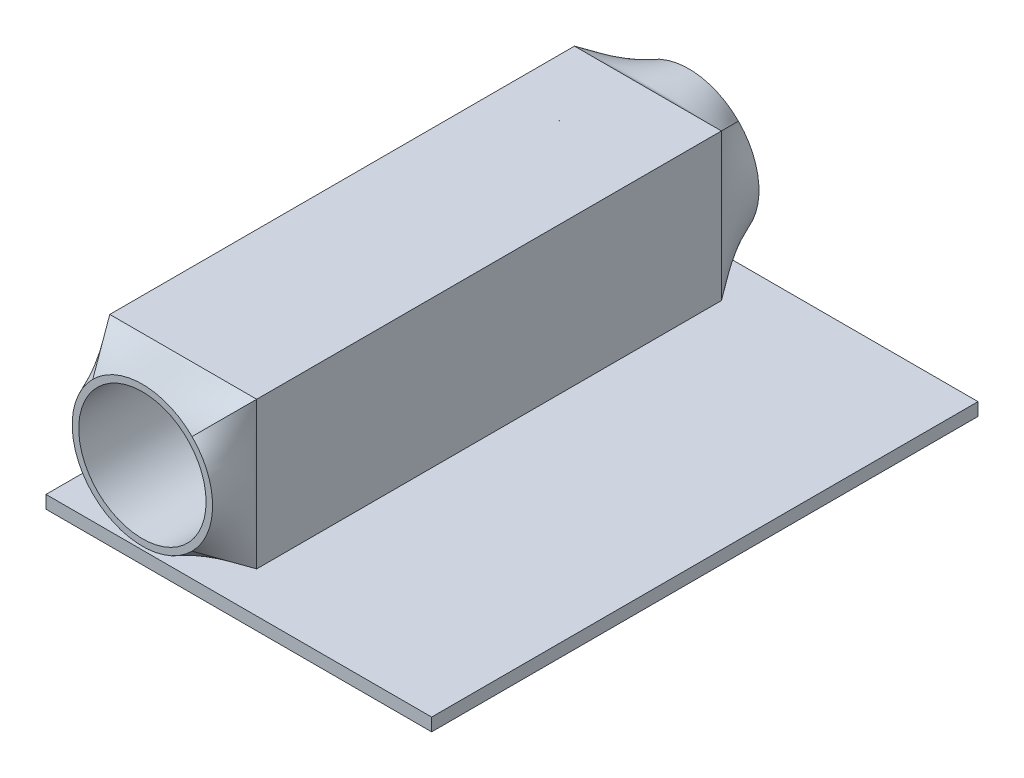
from build123d import *

# Parameters (mm, degrees)
SKETCH1_W                = 60
SKETCH1_H                = 85
FLOOR_2_DEPTH            = 2
BOSS_EXTRUDE2_DEPTH      = 36.15
BOSS_EXTRUDE2_DEPTH_BACK = 36.15
SKETCH4_W                = 22.86
SKETCH4_H                = 22.86
SKETCH8_R                = 9.906
CUT_EXTRUDE1_DEPTH       = 85
SKETCH9_R                = 10
CUT_EXTRUDE3_DEPTH       = 12.7


with BuildPart() as part:
    # Sketch1 → Floor 2 (new body)
    with BuildSketch(Plane(origin=(0, 0, 0), x_dir=(1, 0, 0), z_dir=(0, 1, 0))):
        Rectangle(SKETCH1_W, SKETCH1_H)
    extrude(amount=FLOOR_2_DEPTH)


with BuildPart() as body_2:
    # Sketch4 → Boss-Extrude2 (new, two sides: drawn at the far end of the back side and taken through both)
    with BuildSketch(Plane.XY.offset(-BOSS_EXTRUDE2_DEPTH_BACK)):
        with Locations((-15, 13.43)):
            Rectangle(SKETCH4_W, SKETCH4_H)
    extrude(amount=BOSS_EXTRUDE2_DEPTH + BOSS_EXTRUDE2_DEPTH_BACK)

    # Loft1: read off the stored shape, not the designer's step
    # Loft1: loft between two sections, ruled curve by curve
    loft1_from = [
        Edge.make_bspline([(-22.723020264, 21.153020264, 42.5), (-22.267936931, 21.608103597, 42.5), (-21.755379228, 22.039749576, 42.5), (-20.622186662, 22.819033678, 42.5), (-20.00149393, 23.16641949, 42.5), (-18.674448049, 23.740734093, 42.5), (-17.968198796, 23.967381387, 42.5), (-16.507843764, 24.27310923, 42.5), (-15.754006755, 24.352, 42.5), (-14.245993245, 24.352, 42.5), (-13.492156236, 24.27310923, 42.5), (-12.031801204, 23.967381387, 42.5), (-11.325551951, 23.740734093, 42.5), (-9.99850607, 23.16641949, 42.5), (-9.377813338, 22.819033678, 42.5), (-8.244620772, 22.039749576, 42.5), (-7.732063069, 21.608103597, 42.5), (-7.276979736, 21.153020264, 42.5)], [0, 0, 0, 0, 0.125, 0.125, 0.25, 0.25, 0.375, 0.375, 0.5, 0.5, 0.625, 0.625, 0.75, 0.75, 0.875, 0.875, 1, 1, 1, 1], 3),
        Edge.make_bspline([(-7.276979736, 21.153020264, 42.5), (-6.821896403, 20.697936931, 42.5), (-6.390250424, 20.185379228, 42.5), (-5.610966322, 19.052186662, 42.5), (-5.26358051, 18.43149393, 42.5), (-4.689265907, 17.104448049, 42.5), (-4.462618613, 16.398198796, 42.5), (-4.15689077, 14.937843764, 42.5), (-4.078, 14.184006755, 42.5), (-4.078, 12.675993245, 42.5), (-4.15689077, 11.922156236, 42.5), (-4.462618613, 10.461801204, 42.5), (-4.689265907, 9.755551951, 42.5), (-5.26358051, 8.42850607, 42.5), (-5.610966322, 7.807813338, 42.5), (-6.390250424, 6.674620772, 42.5), (-6.821896403, 6.162063069, 42.5), (-7.276979736, 5.706979736, 42.5)], [0, 0, 0, 0, 0.125, 0.125, 0.25, 0.25, 0.375, 0.375, 0.5, 0.5, 0.625, 0.625, 0.75, 0.75, 0.875, 0.875, 1, 1, 1, 1], 3),
        Edge.make_bspline([(-22.723020264, 5.706979736, 42.5), (-23.178103597, 6.162063069, 42.5), (-23.609749576, 6.674620772, 42.5), (-24.389033678, 7.807813338, 42.5), (-24.73641949, 8.42850607, 42.5), (-25.310734093, 9.755551951, 42.5), (-25.537381387, 10.461801204, 42.5), (-25.84310923, 11.922156236, 42.5), (-25.922, 12.675993245, 42.5), (-25.922, 14.184006755, 42.5), (-25.84310923, 14.937843764, 42.5), (-25.537381387, 16.398198796, 42.5), (-25.310734093, 17.104448049, 42.5), (-24.73641949, 18.43149393, 42.5), (-24.389033678, 19.052186662, 42.5), (-23.609749576, 20.185379228, 42.5), (-23.178103597, 20.697936931, 42.5), (-22.723020264, 21.153020264, 42.5)], [0, 0, 0, 0, 0.125, 0.125, 0.25, 0.25, 0.375, 0.375, 0.5, 0.5, 0.625, 0.625, 0.75, 0.75, 0.875, 0.875, 1, 1, 1, 1], 3),
        Edge.make_bspline([(-7.276979736, 5.706979736, 42.5), (-7.732063069, 5.251896403, 42.5), (-8.244620772, 4.820250424, 42.5), (-9.377813338, 4.040966322, 42.5), (-9.99850607, 3.69358051, 42.5), (-11.325551951, 3.119265907, 42.5), (-12.031801204, 2.892618613, 42.5), (-13.492156236, 2.58689077, 42.5), (-14.245993245, 2.508, 42.5), (-15.754006755, 2.508, 42.5), (-16.507843764, 2.58689077, 42.5), (-17.968198796, 2.892618613, 42.5), (-18.674448049, 3.119265907, 42.5), (-20.00149393, 3.69358051, 42.5), (-20.622186662, 4.040966322, 42.5), (-21.755379228, 4.820250424, 42.5), (-22.267936931, 5.251896403, 42.5), (-22.723020264, 5.706979736, 42.5)], [0, 0, 0, 0, 0.125, 0.125, 0.25, 0.25, 0.375, 0.375, 0.5, 0.5, 0.625, 0.625, 0.75, 0.75, 0.875, 0.875, 1, 1, 1, 1], 3),
    ]
    loft1_to = [
        Edge.make_bspline([(-26.43, 24.86, 36.15), (-25.4775, 24.86, 36.15), (-24.525, 24.86, 36.15), (-22.62, 24.86, 36.15), (-21.6675, 24.86, 36.15), (-19.7625, 24.86, 36.15), (-18.81, 24.86, 36.15), (-16.905, 24.86, 36.15), (-15.9525, 24.86, 36.15), (-14.0475, 24.86, 36.15), (-13.095, 24.86, 36.15), (-11.19, 24.86, 36.15), (-10.2375, 24.86, 36.15), (-8.3325, 24.86, 36.15), (-7.38, 24.86, 36.15), (-5.475, 24.86, 36.15), (-4.5225, 24.86, 36.15), (-3.57, 24.86, 36.15)], [0, 0, 0, 0, 0.125, 0.125, 0.25, 0.25, 0.375, 0.375, 0.5, 0.5, 0.625, 0.625, 0.75, 0.75, 0.875, 0.875, 1, 1, 1, 1], 3),
        Edge.make_bspline([(-3.57, 24.86, 36.15), (-3.57, 23.9075, 36.15), (-3.57, 22.955, 36.15), (-3.57, 21.05, 36.15), (-3.57, 20.0975, 36.15), (-3.57, 18.1925, 36.15), (-3.57, 17.24, 36.15), (-3.57, 15.335, 36.15), (-3.57, 14.3825, 36.15), (-3.57, 12.4775, 36.15), (-3.57, 11.525, 36.15), (-3.57, 9.62, 36.15), (-3.57, 8.6675, 36.15), (-3.57, 6.7625, 36.15), (-3.57, 5.81, 36.15), (-3.57, 3.905, 36.15), (-3.57, 2.9525, 36.15), (-3.57, 2, 36.15)], [0, 0, 0, 0, 0.125, 0.125, 0.25, 0.25, 0.375, 0.375, 0.5, 0.5, 0.625, 0.625, 0.75, 0.75, 0.875, 0.875, 1, 1, 1, 1], 3),
        Edge.make_bspline([(-26.43, 2, 36.15), (-26.43, 2.9525, 36.15), (-26.43, 3.905, 36.15), (-26.43, 5.81, 36.15), (-26.43, 6.7625, 36.15), (-26.43, 8.6675, 36.15), (-26.43, 9.62, 36.15), (-26.43, 11.525, 36.15), (-26.43, 12.4775, 36.15), (-26.43, 14.3825, 36.15), (-26.43, 15.335, 36.15), (-26.43, 17.24, 36.15), (-26.43, 18.1925, 36.15), (-26.43, 20.0975, 36.15), (-26.43, 21.05, 36.15), (-26.43, 22.955, 36.15), (-26.43, 23.9075, 36.15), (-26.43, 24.86, 36.15)], [0, 0, 0, 0, 0.125, 0.125, 0.25, 0.25, 0.375, 0.375, 0.5, 0.5, 0.625, 0.625, 0.75, 0.75, 0.875, 0.875, 1, 1, 1, 1], 3),
        Edge.make_bspline([(-3.57, 2, 36.15), (-4.5225, 2, 36.15), (-5.475, 2, 36.15), (-7.38, 2, 36.15), (-8.3325, 2, 36.15), (-10.2375, 2, 36.15), (-11.19, 2, 36.15), (-13.095, 2, 36.15), (-14.0475, 2, 36.15), (-15.9525, 2, 36.15), (-16.905, 2, 36.15), (-18.81, 2, 36.15), (-19.7625, 2, 36.15), (-21.6675, 2, 36.15), (-22.62, 2, 36.15), (-24.525, 2, 36.15), (-25.4775, 2, 36.15), (-26.43, 2, 36.15)], [0, 0, 0, 0, 0.125, 0.125, 0.25, 0.25, 0.375, 0.375, 0.5, 0.5, 0.625, 0.625, 0.75, 0.75, 0.875, 0.875, 1, 1, 1, 1], 3),
    ]
    loft1 = Solid(Shell([*[Face.make_surface_from_curves(loft1_from[k], loft1_to[k]) for k in range(4)], Face(Wire(loft1_from)), Face(Wire(loft1_to))]))
    add(loft1)

    # Loft2: read off the stored shape, not the designer's step
    # Loft2: loft between two sections, ruled curve by curve
    loft2_from = [
        Edge.make_bspline([(-7.276979736, 21.153020264, -42.5), (-7.732063069, 21.608103597, -42.5), (-8.244620772, 22.039749576, -42.5), (-9.377813338, 22.819033678, -42.5), (-9.99850607, 23.16641949, -42.5), (-11.325551951, 23.740734093, -42.5), (-12.031801204, 23.967381387, -42.5), (-13.492156236, 24.27310923, -42.5), (-14.245993245, 24.352, -42.5), (-15.754006755, 24.352, -42.5), (-16.507843764, 24.27310923, -42.5), (-17.968198796, 23.967381387, -42.5), (-18.674448049, 23.740734093, -42.5), (-20.00149393, 23.16641949, -42.5), (-20.622186662, 22.819033678, -42.5), (-21.755379228, 22.039749576, -42.5), (-22.267936931, 21.608103597, -42.5), (-22.723020264, 21.153020264, -42.5)], [0, 0, 0, 0, 0.125, 0.125, 0.25, 0.25, 0.375, 0.375, 0.5, 0.5, 0.625, 0.625, 0.75, 0.75, 0.875, 0.875, 1, 1, 1, 1], 3),
        Edge.make_bspline([(-22.723020264, 21.153020264, -42.5), (-23.178103597, 20.697936931, -42.5), (-23.609749576, 20.185379228, -42.5), (-24.389033678, 19.052186662, -42.5), (-24.73641949, 18.43149393, -42.5), (-25.310734093, 17.104448049, -42.5), (-25.537381387, 16.398198796, -42.5), (-25.84310923, 14.937843764, -42.5), (-25.922, 14.184006755, -42.5), (-25.922, 12.675993245, -42.5), (-25.84310923, 11.922156236, -42.5), (-25.537381387, 10.461801204, -42.5), (-25.310734093, 9.755551951, -42.5), (-24.73641949, 8.42850607, -42.5), (-24.389033678, 7.807813338, -42.5), (-23.609749576, 6.674620772, -42.5), (-23.178103597, 6.162063069, -42.5), (-22.723020264, 5.706979736, -42.5)], [0, 0, 0, 0, 0.125, 0.125, 0.25, 0.25, 0.375, 0.375, 0.5, 0.5, 0.625, 0.625, 0.75, 0.75, 0.875, 0.875, 1, 1, 1, 1], 3),
        Edge.make_bspline([(-7.276979736, 5.706979736, -42.5), (-6.821896403, 6.162063069, -42.5), (-6.390250424, 6.674620772, -42.5), (-5.610966322, 7.807813338, -42.5), (-5.26358051, 8.42850607, -42.5), (-4.689265907, 9.755551951, -42.5), (-4.462618613, 10.461801204, -42.5), (-4.15689077, 11.922156236, -42.5), (-4.078, 12.675993245, -42.5), (-4.078, 14.184006755, -42.5), (-4.15689077, 14.937843764, -42.5), (-4.462618613, 16.398198796, -42.5), (-4.689265907, 17.104448049, -42.5), (-5.26358051, 18.43149393, -42.5), (-5.610966322, 19.052186662, -42.5), (-6.390250424, 20.185379228, -42.5), (-6.821896403, 20.697936931, -42.5), (-7.276979736, 21.153020264, -42.5)], [0, 0, 0, 0, 0.125, 0.125, 0.25, 0.25, 0.375, 0.375, 0.5, 0.5, 0.625, 0.625, 0.75, 0.75, 0.875, 0.875, 1, 1, 1, 1], 3),
        Edge.make_bspline([(-22.723020264, 5.706979736, -42.5), (-22.267936931, 5.251896403, -42.5), (-21.755379228, 4.820250424, -42.5), (-20.622186662, 4.040966322, -42.5), (-20.00149393, 3.69358051, -42.5), (-18.674448049, 3.119265907, -42.5), (-17.968198796, 2.892618613, -42.5), (-16.507843764, 2.58689077, -42.5), (-15.754006755, 2.508, -42.5), (-14.245993245, 2.508, -42.5), (-13.492156236, 2.58689077, -42.5), (-12.031801204, 2.892618613, -42.5), (-11.325551951, 3.119265907, -42.5), (-9.99850607, 3.69358051, -42.5), (-9.377813338, 4.040966322, -42.5), (-8.244620772, 4.820250424, -42.5), (-7.732063069, 5.251896403, -42.5), (-7.276979736, 5.706979736, -42.5)], [0, 0, 0, 0, 0.125, 0.125, 0.25, 0.25, 0.375, 0.375, 0.5, 0.5, 0.625, 0.625, 0.75, 0.75, 0.875, 0.875, 1, 1, 1, 1], 3),
    ]
    loft2_to = [
        Edge.make_bspline([(-3.57, 24.86, -36.15), (-4.5225, 24.86, -36.15), (-5.475, 24.86, -36.15), (-7.38, 24.86, -36.15), (-8.3325, 24.86, -36.15), (-10.2375, 24.86, -36.15), (-11.19, 24.86, -36.15), (-13.095, 24.86, -36.15), (-14.0475, 24.86, -36.15), (-15.9525, 24.86, -36.15), (-16.905, 24.86, -36.15), (-18.81, 24.86, -36.15), (-19.7625, 24.86, -36.15), (-21.6675, 24.86, -36.15), (-22.62, 24.86, -36.15), (-24.525, 24.86, -36.15), (-25.4775, 24.86, -36.15), (-26.43, 24.86, -36.15)], [0, 0, 0, 0, 0.125, 0.125, 0.25, 0.25, 0.375, 0.375, 0.5, 0.5, 0.625, 0.625, 0.75, 0.75, 0.875, 0.875, 1, 1, 1, 1], 3),
        Edge.make_bspline([(-26.43, 24.86, -36.15), (-26.43, 23.9075, -36.15), (-26.43, 22.955, -36.15), (-26.43, 21.05, -36.15), (-26.43, 20.0975, -36.15), (-26.43, 18.1925, -36.15), (-26.43, 17.24, -36.15), (-26.43, 15.335, -36.15), (-26.43, 14.3825, -36.15), (-26.43, 12.4775, -36.15), (-26.43, 11.525, -36.15), (-26.43, 9.62, -36.15), (-26.43, 8.6675, -36.15), (-26.43, 6.7625, -36.15), (-26.43, 5.81, -36.15), (-26.43, 3.905, -36.15), (-26.43, 2.9525, -36.15), (-26.43, 2, -36.15)], [0, 0, 0, 0, 0.125, 0.125, 0.25, 0.25, 0.375, 0.375, 0.5, 0.5, 0.625, 0.625, 0.75, 0.75, 0.875, 0.875, 1, 1, 1, 1], 3),
        Edge.make_bspline([(-3.57, 2, -36.15), (-3.57, 2.9525, -36.15), (-3.57, 3.905, -36.15), (-3.57, 5.81, -36.15), (-3.57, 6.7625, -36.15), (-3.57, 8.6675, -36.15), (-3.57, 9.62, -36.15), (-3.57, 11.525, -36.15), (-3.57, 12.4775, -36.15), (-3.57, 14.3825, -36.15), (-3.57, 15.335, -36.15), (-3.57, 17.24, -36.15), (-3.57, 18.1925, -36.15), (-3.57, 20.0975, -36.15), (-3.57, 21.05, -36.15), (-3.57, 22.955, -36.15), (-3.57, 23.9075, -36.15), (-3.57, 24.86, -36.15)], [0, 0, 0, 0, 0.125, 0.125, 0.25, 0.25, 0.375, 0.375, 0.5, 0.5, 0.625, 0.625, 0.75, 0.75, 0.875, 0.875, 1, 1, 1, 1], 3),
        Edge.make_bspline([(-26.43, 2, -36.15), (-25.4775, 2, -36.15), (-24.525, 2, -36.15), (-22.62, 2, -36.15), (-21.6675, 2, -36.15), (-19.7625, 2, -36.15), (-18.81, 2, -36.15), (-16.905, 2, -36.15), (-15.9525, 2, -36.15), (-14.0475, 2, -36.15), (-13.095, 2, -36.15), (-11.19, 2, -36.15), (-10.2375, 2, -36.15), (-8.3325, 2, -36.15), (-7.38, 2, -36.15), (-5.475, 2, -36.15), (-4.5225, 2, -36.15), (-3.57, 2, -36.15)], [0, 0, 0, 0, 0.125, 0.125, 0.25, 0.25, 0.375, 0.375, 0.5, 0.5, 0.625, 0.625, 0.75, 0.75, 0.875, 0.875, 1, 1, 1, 1], 3),
    ]
    loft2 = Solid(Shell([*[Face.make_surface_from_curves(loft2_from[k], loft2_to[k]) for k in range(4)], Face(Wire(loft2_from)), Face(Wire(loft2_to))]))
    add(loft2)

    # Sketch8 → Cut-Extrude1 (cut)
    with BuildSketch(Plane.XY.offset(42.5)):
        with Locations((-15, 13.43)):
            Circle(SKETCH8_R)
    extrude(amount=-CUT_EXTRUDE1_DEPTH, mode=Mode.SUBTRACT)


with BuildPart() as cut_extrude3_tool:
    # Sketch9 → Cut-Extrude3 (new body)
    with BuildSketch(Plane.XZ):
        with Locations(Location((-15, -27.5, 0), (0, 0, 239.882705253))):
            Circle(SKETCH9_R)
    extrude(amount=-CUT_EXTRUDE3_DEPTH)


with BuildPart() as part_1:
    add(part.part)

    # Cut-Extrude3: cut by cut_extrude3_tool
    add(cut_extrude3_tool.part, mode=Mode.SUBTRACT)


with BuildPart() as body_2_1:
    add(body_2.part)

    # Cut-Extrude3: cut by cut_extrude3_tool
    add(cut_extrude3_tool.part, mode=Mode.SUBTRACT)


solid = Compound([part_1.part, body_2_1.part])
